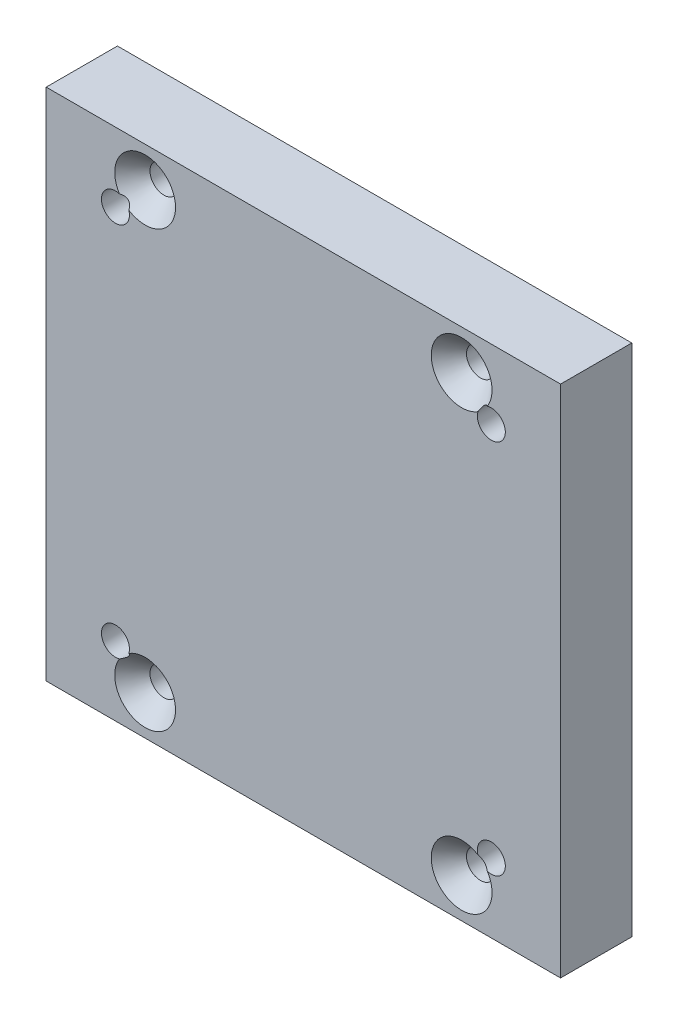
from build123d import *

# Parameters (mm, degrees)
SKETCH1_W                                      = 82.55
SKETCH1_H                                      = 82.55
BOSS_EXTRUDE1_DEPTH                            = 11.43
SKETCH2_R                                      = 38.1
CUT_EXTRUDE1_DEPTH                             = 8.89
CSK_FOR_8_FLAT_HEAD_MACHINE_SCREW1_D           = 4.4958
CSK_FOR_8_FLAT_HEAD_MACHINE_SCREW1_CSINK_D     = 9.7576132
CSK_FOR_8_FLAT_HEAD_MACHINE_SCREW1_CSINK_ANGLE = 82
F_8_CLEARANCE_HOLE1_D                          = 4.4958


with BuildPart() as part:
    # Sketch1 → Boss-Extrude1 (new body)
    with BuildSketch(Plane.XY):
        Rectangle(SKETCH1_W, SKETCH1_H)
    extrude(amount=BOSS_EXTRUDE1_DEPTH)

    # Sketch2 → Cut-Extrude1 (cut)
    with BuildSketch(Plane(origin=(0, 0, 0), x_dir=(-1, 0, 0), z_dir=(0, 0, -1))):
        Circle(SKETCH2_R)
    extrude(amount=-CUT_EXTRUDE1_DEPTH, mode=Mode.SUBTRACT)

    # CSK for #8 Flat Head Machine Screw1 (through all)
    with Locations(Plane.XY.offset(11.43)):
        with Locations((25.4, 34.925), (-25.4, 34.925), (-25.4, -34.925), (25.4, -34.925)):
            CounterSinkHole(CSK_FOR_8_FLAT_HEAD_MACHINE_SCREW1_D / 2, CSK_FOR_8_FLAT_HEAD_MACHINE_SCREW1_CSINK_D / 2, counter_sink_angle=CSK_FOR_8_FLAT_HEAD_MACHINE_SCREW1_CSINK_ANGLE)

    # #8 Clearance Hole1 (through all)
    with Locations(Plane.XY.offset(11.43)):
        with Locations((30.1625, -30.1625), (-30.1625, 30.1625), (-30.1625, -30.1625), (30.1625, 30.1625)):
            Hole(F_8_CLEARANCE_HOLE1_D / 2)


solid = part.part
